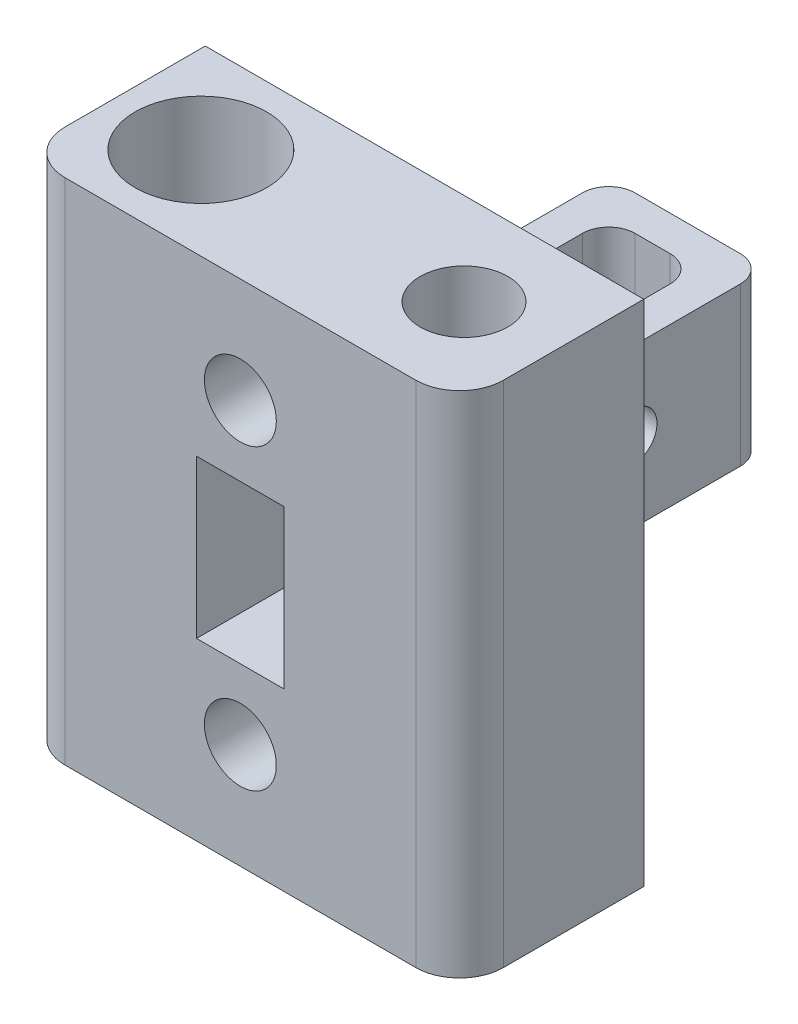
from build123d import *

# Parameters (mm, degrees)
SKETCH1_W           = 50
SKETCH1_H           = 21
BOSS_EXTRUDE1_DEPTH = 58
SKETCH3_R           = 7.5
CUT_EXTRUDE1_DEPTH  = 24
CUT_EXTRUDE2_REACH  = 66.025
SKETCH4_R           = 5
CUT_EXTRUDE3_START  = -24
SKETCH5_R           = 7.5
CUT_EXTRUDE3_DEPTH  = 24
CUT_EXTRUDE4_REACH  = 66.025
SKETCH6_R           = 4.5
CUT_EXTRUDE5_REACH  = 68.558
SKETCH8_W           = 10
SKETCH8_H           = 18
SKETCH7_R           = 4.1
CUT_EXTRUDE6_DEPTH  = 15
SKETCH11_W          = 4
SKETCH11_H          = 18
BOSS_EXTRUDE2_DEPTH = 26
SKETCH12_W          = 18
SKETCH12_H          = 18
BOSS_EXTRUDE3_DEPTH = 4
CUT_EXTRUDE7_DEPTH  = 79.487260113
FILLET1_R           = 5
FILLET2_R           = 5
FILLET3_R           = 3


with BuildPart() as part:
    # Sketch1 → Boss-Extrude1 (new body)
    with BuildSketch(Plane(origin=(0, 0, 0), x_dir=(1, 0, 0), z_dir=(0, 1, 0))):
        Rectangle(SKETCH1_W, SKETCH1_H)
    extrude(amount=BOSS_EXTRUDE1_DEPTH)

    # Sketch3 → Cut-Extrude1 (cut)
    with BuildSketch(Plane(origin=(0, 58, 0), x_dir=(1, 0, 0), z_dir=(0, 1, 0))):
        with Locations((-15, 0)):
            Circle(SKETCH3_R)
    extrude(amount=-CUT_EXTRUDE1_DEPTH, mode=Mode.SUBTRACT)

    # Sketch4 → Cut-Extrude2 (cut, up to next)
    with BuildSketch(Plane(origin=(0, 58, 0), x_dir=(1, 0, 0), z_dir=(0, 1, 0)), mode=Mode.PRIVATE) as cut_extrude2_sk1:
        with Locations((15, 0)):
            Circle(SKETCH4_R)
    cut_extrude2_tool1 = extrude(cut_extrude2_sk1.sketch, amount=-CUT_EXTRUDE2_REACH, mode=Mode.PRIVATE) & part.part
    add(cut_extrude2_tool1.solids().sort_by_distance((15, 58, 0))[0], mode=Mode.SUBTRACT)

    # Sketch5 → Cut-Extrude3 (cut)
    with BuildSketch(Plane.XZ.offset(CUT_EXTRUDE3_START)):
        with Locations((-15, 0)):
            Circle(SKETCH5_R)
    extrude(amount=CUT_EXTRUDE3_DEPTH, mode=Mode.SUBTRACT)

    # Sketch6 → Cut-Extrude4 (cut, up to next)
    with BuildSketch(Plane.XZ, mode=Mode.PRIVATE) as cut_extrude4_sk1:
        with Locations((-15, 0)):
            Circle(SKETCH6_R)
    cut_extrude4_tool1 = extrude(cut_extrude4_sk1.sketch, amount=-CUT_EXTRUDE4_REACH, mode=Mode.PRIVATE) & part.part
    add(cut_extrude4_tool1.solids().sort_by_distance((-15, 0, 0))[0], mode=Mode.SUBTRACT)

    # Sketch8 → Cut-Extrude5 (cut, up to next)
    with BuildSketch(Plane.XY.offset(10.5), mode=Mode.PRIVATE) as cut_extrude5_sk1:
        with Locations((0, 29)):
            Rectangle(SKETCH8_W, SKETCH8_H)
    cut_extrude5_tool1 = extrude(cut_extrude5_sk1.sketch, amount=-CUT_EXTRUDE5_REACH, mode=Mode.PRIVATE) & part.part
    add(cut_extrude5_tool1.solids().sort_by_distance((0, 29, 10.5))[0], mode=Mode.SUBTRACT)

    # Sketch7 → Cut-Extrude6 (cut)
    with BuildSketch(Plane.XY.offset(10.5)):
        with Locations((0, 46)):
            Circle(SKETCH7_R)
        with Locations((0, 12)):
            Circle(SKETCH7_R)
    extrude(amount=-CUT_EXTRUDE6_DEPTH, mode=Mode.SUBTRACT)

    # Sketch11 → Boss-Extrude2 (add)
    with BuildSketch(Plane(origin=(0, 0, -10.5), x_dir=(-1, 0, 0), z_dir=(0, 0, -1))):
        with Locations((7, 29)):
            Rectangle(SKETCH11_W, SKETCH11_H)
        with Locations((-7, 29)):
            Rectangle(SKETCH11_W, SKETCH11_H)
    extrude(amount=BOSS_EXTRUDE2_DEPTH)

    # Sketch12 → Boss-Extrude3 (add)
    with BuildSketch(Plane(origin=(0, 0, -36.5), x_dir=(-1, 0, 0), z_dir=(0, 0, -1))):
        with Locations((0, 29)):
            Rectangle(SKETCH12_W, SKETCH12_H)
    extrude(amount=BOSS_EXTRUDE3_DEPTH)

    # Sketch13 → Cut-Extrude7 (cut, through all)
    with BuildSketch(Plane(origin=(9, 0, 0), x_dir=(0, 0, -1), z_dir=(1, 0, 0))):
        with BuildLine():
            Line((16.25, 31.75), (25.25, 31.75))
            ThreePointArc((25.25, 31.75), (28, 29), (25.25, 26.25))
            Line((25.25, 26.25), (16.25, 26.25))
            ThreePointArc((16.25, 26.25), (13.5, 29), (16.25, 31.75))
        make_face()
    extrude(amount=-CUT_EXTRUDE7_DEPTH, mode=Mode.SUBTRACT)

    # Fillet1
    fillet1_edges = [part.edges().sort_by_distance(p)[0] for p in [
        (-25, 29, 10.5),
        (25, 29, 10.5),
    ]]
    fillet(fillet1_edges, radius=FILLET1_R)

    # Fillet2
    fillet2_edges = [part.edges().sort_by_distance(p)[0] for p in [
        (-7, 20, -10.5),
        (7, 20, -10.5),
        (-7, 38, -10.5),
        (7, 38, -10.5),
    ]]
    fillet(fillet2_edges, radius=FILLET2_R)

    # Fillet3
    fillet3_edges = [part.edges().sort_by_distance(p)[0] for p in [
        (-5, 29, -36.5),
        (5, 29, -36.5),
        (-9, 29, -40.5),
        (9, 29, -40.5),
    ]]
    fillet(fillet3_edges, radius=FILLET3_R)


solid = part.part
